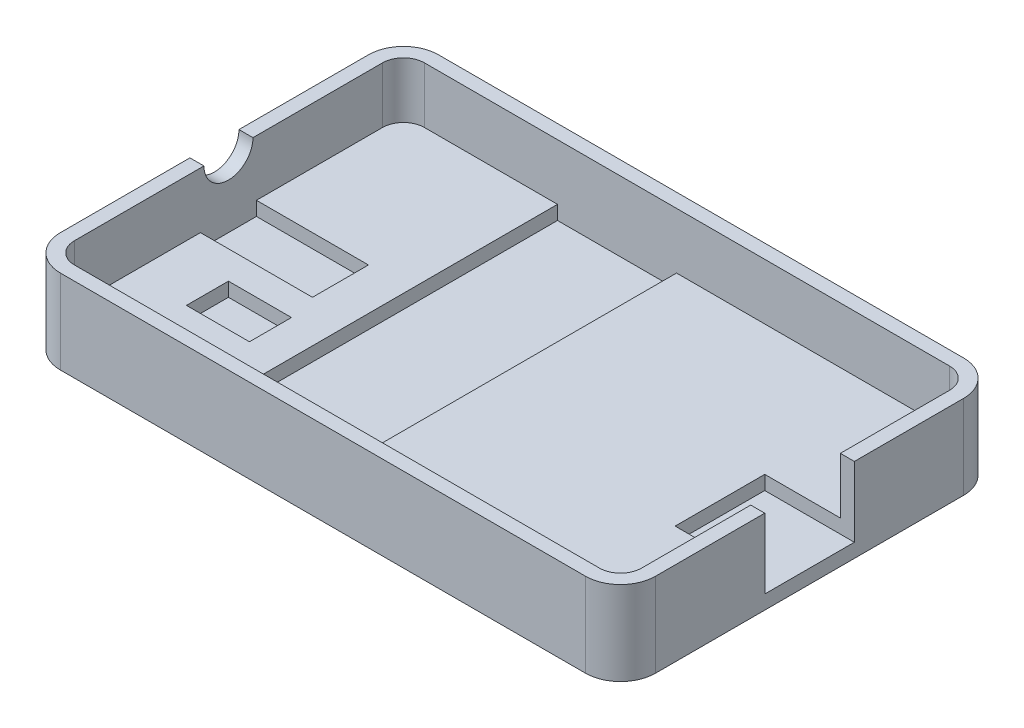
from build123d import *

# Parameters (mm, degrees)
SKETCH1_W           = 42.5
SKETCH1_H           = 27
BOSS_EXTRUDE1_DEPTH = 6
SKETCH2_W           = 40.5
SKETCH2_H           = 25
CUT_EXTRUDE1_DEPTH  = 4
SKETCH3_W           = 6.4
SKETCH3_H           = 6.4
CUT_EXTRUDE2_DEPTH  = 5
CUT_EXTRUDE3_REACH  = 46.994
SKETCH4_R           = 1.75
SKETCH5_W           = 8.5
SKETCH5_H           = 25
CUT_EXTRUDE4_DEPTH  = 1
SKETCH6_W           = 8
SKETCH6_H           = 4
CUT_EXTRUDE5_DEPTH  = 1
SKETCH7_W           = 4.5
SKETCH7_H           = 3
CUT_EXTRUDE6_DEPTH  = 1
FILLET1_R           = 1.5
FILLET2_R           = 2.5


with BuildPart() as part:
    # Sketch1 → Boss-Extrude1 (new body)
    with BuildSketch(Plane(origin=(0, 0, 0), x_dir=(1, 0, 0), z_dir=(0, 1, 0))):
        Rectangle(SKETCH1_W, SKETCH1_H)
    extrude(amount=BOSS_EXTRUDE1_DEPTH)

    # Sketch2 → Cut-Extrude1 (cut)
    with BuildSketch(Plane(origin=(0, 6, 0), x_dir=(1, 0, 0), z_dir=(0, 1, 0))):
        Rectangle(SKETCH2_W, SKETCH2_H)
    extrude(amount=-CUT_EXTRUDE1_DEPTH, mode=Mode.SUBTRACT)

    # Sketch3 → Cut-Extrude2 (cut)
    with BuildSketch(Plane(origin=(0, 6, 0), x_dir=(1, 0, 0), z_dir=(0, 1, 0))):
        with Locations((18.05, 0)):
            Rectangle(SKETCH3_W, SKETCH3_H)
    extrude(amount=-CUT_EXTRUDE2_DEPTH, mode=Mode.SUBTRACT)

    # Sketch4 → Cut-Extrude3 (cut, up to next)
    with BuildSketch(Plane.ZY.offset(21.25), mode=Mode.PRIVATE) as cut_extrude3_sk1:
        with Locations((0, 6)):
            Circle(SKETCH4_R)
    cut_extrude3_tool1 = extrude(cut_extrude3_sk1.sketch, amount=-CUT_EXTRUDE3_REACH, mode=Mode.PRIVATE) & part.part
    add(cut_extrude3_tool1.solids().sort_by_distance((-21.25, 6, 0))[0], mode=Mode.SUBTRACT)

    # Sketch5 → Cut-Extrude4 (cut)
    with BuildSketch(Plane(origin=(0, 2, 0), x_dir=(1, 0, 0), z_dir=(0, 1, 0))):
        with Locations((-5, 0)):
            Rectangle(SKETCH5_W, SKETCH5_H)
    extrude(amount=-CUT_EXTRUDE4_DEPTH, mode=Mode.SUBTRACT)

    # Sketch6 → Cut-Extrude5 (cut)
    with BuildSketch(Plane(origin=(0, 2, 0), x_dir=(1, 0, 0), z_dir=(0, 1, 0))):
        with Locations((-16.25, 0)):
            Rectangle(SKETCH6_W, SKETCH6_H)
    extrude(amount=-CUT_EXTRUDE5_DEPTH, mode=Mode.SUBTRACT)

    # Sketch7 → Cut-Extrude6 (cut)
    with BuildSketch(Plane(origin=(0, 2, 0), x_dir=(1, 0, 0), z_dir=(0, 1, 0))):
        with Locations((-14, -5.5)):
            Rectangle(SKETCH7_W, SKETCH7_H)
    extrude(amount=-CUT_EXTRUDE6_DEPTH, mode=Mode.SUBTRACT)

    # Fillet1
    fillet1_edges = [part.edges().sort_by_distance(p)[0] for p in [
        (20.25, 4, 12.5),
        (-20.25, 4, 12.5),
        (20.25, 4, -12.5),
        (-20.25, 4, -12.5),
    ]]
    fillet(fillet1_edges, radius=FILLET1_R)

    # Fillet2
    fillet2_edges = [part.edges().sort_by_distance(p)[0] for p in [
        (-21.25, 3, -13.5),
        (21.25, 3, -13.5),
        (21.25, 3, 13.5),
        (-21.25, 3, 13.5),
    ]]
    fillet(fillet2_edges, radius=FILLET2_R)


solid = part.part
